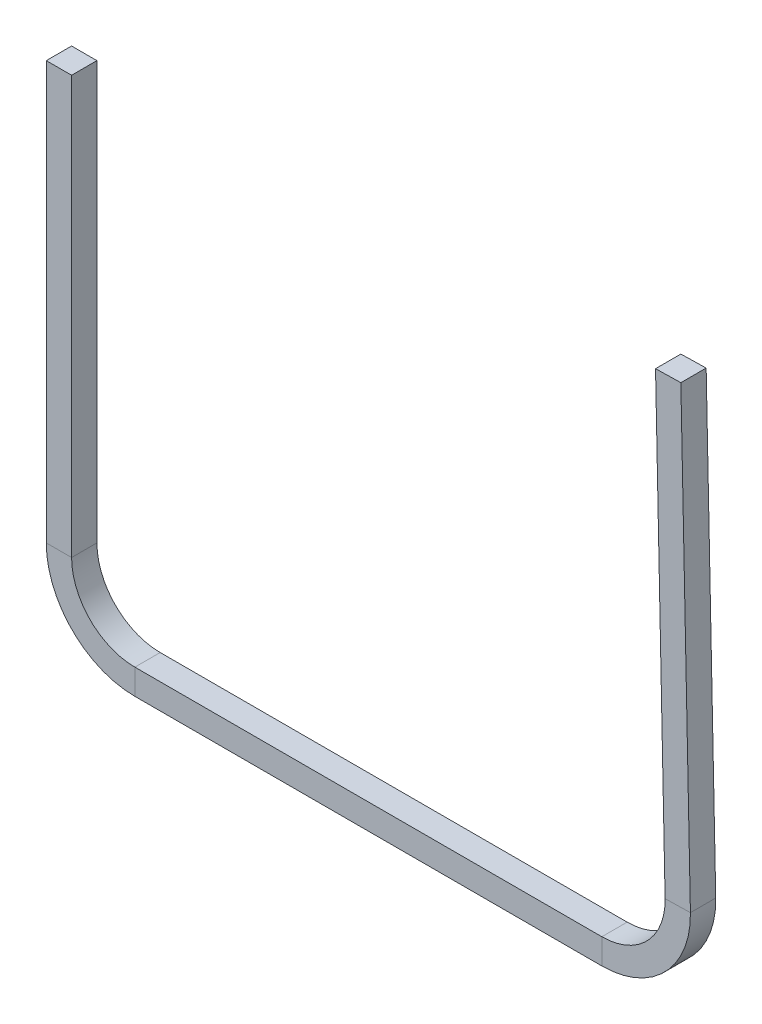
from build123d import *

# Parameters (mm, degrees)
TABAN_FLAN_1_DEPTH = 10


# Sheet-metal steps are written as plain solids
with BuildPart() as part:
    # Çizim1 → Taban-Flanş1 (new body)
    with BuildSketch(Plane.XY):
        with BuildLine():
            Line((0, 0), (0, -165))
            ThreePointArc((0, -165), (7.32233047, -182.67766953), (25, -190))
            Line((25, -190), (209.468144658, -190))
            ThreePointArc((209.468144658, -190), (227.330884927, -182.490640643), (234.462606333, -164.473800807))
            Line((234.462606333, -164.473800807), (230.685166616, 14.954585733))
            Line((230.685166616, 14.954585733), (240.682951286, 15.16506541))
            Line((240.682951286, 15.16506541), (244.460391003, -164.26332113))
            ThreePointArc((244.460391003, -164.26332113), (234.475981035, -189.4868969), (209.468144658, -200))
            Line((209.468144658, -200), (25, -200))
            ThreePointArc((25, -200), (0.251262658, -189.748737342), (-10, -165))
            Line((-10, -165), (-10, 0))
            Line((-10, 0), (0, 0))
        make_face()
    extrude(amount=TABAN_FLAN_1_DEPTH)


solid = part.part
